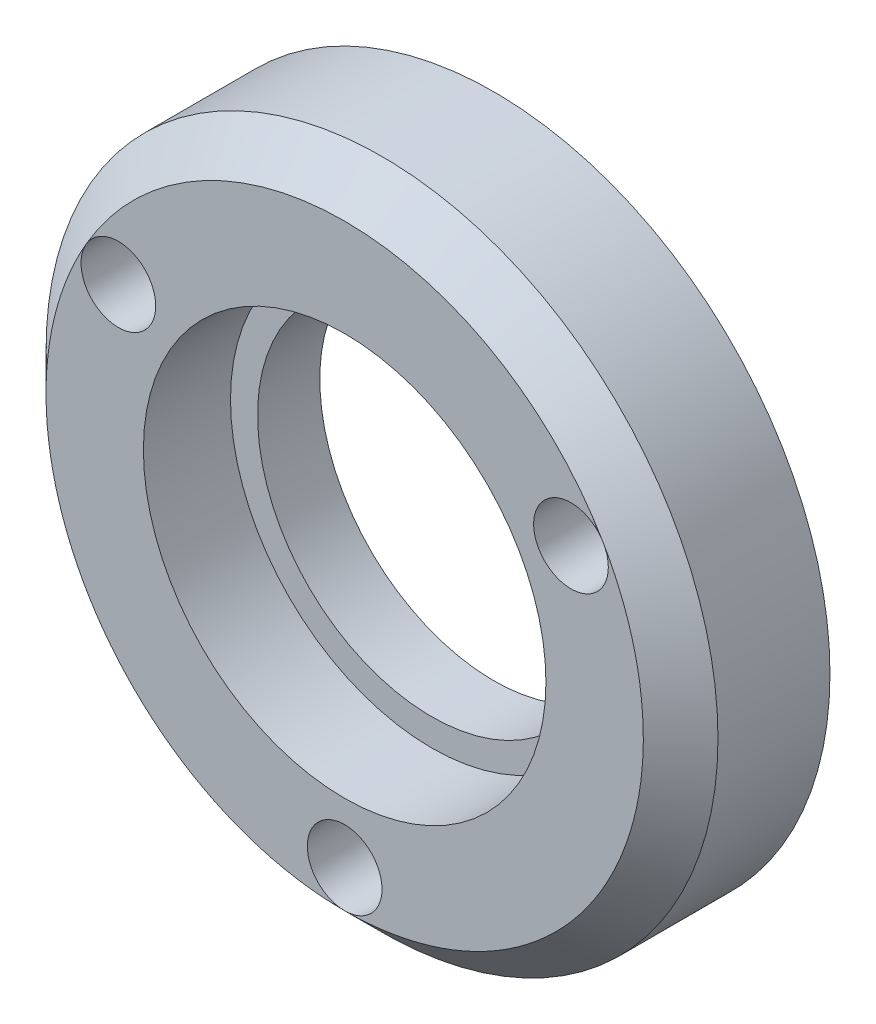
from build123d import *

# Parameters (mm, degrees)
SKETCH_1_R             = 27
EXTRUDE_420_DEPTH      = 12
SKETCH_2_R             = 16.175
CUT_EXTRUDE_563_DEPTH  = 7
SKETCH_3_R             = 14
CUT_EXTRUDE_654_DEPTH  = 39.820097888
SKETCH_5_R             = 1.65
CUT_EXTRUDE_1017_DEPTH = 41.024992192
SKETCH_6_R             = 3
CUT_EXTRUDE_1196_DEPTH = 5
CHAMFER_1_SIZE         = 1.5
CHAMFER_2_SIZE         = 3
SKETCH_8_R             = 3.65
CUT_EXTRUDE_1692_DEPTH = 3


# Some blends are built 0.0001 mm under size
with BuildPart() as part:
    # Эскиз1 → Extrude 420 (new body)
    with BuildSketch(Plane.XY):
        Circle(SKETCH_1_R)
    extrude(amount=EXTRUDE_420_DEPTH)

    # Эскиз2 → Cut-Extrude 563 (cut)
    with BuildSketch(Plane.XY.offset(12)):
        Circle(SKETCH_2_R)
    extrude(amount=-CUT_EXTRUDE_563_DEPTH, mode=Mode.SUBTRACT)

    # Эскиз3 → Cut-Extrude 654 (cut, through all)
    with BuildSketch(Plane.XY.offset(5)):
        Circle(SKETCH_3_R)
    extrude(amount=-CUT_EXTRUDE_654_DEPTH, mode=Mode.SUBTRACT)

    # Эскиз5 → Cut-Extrude 1017 (cut, through all)
    with BuildSketch(Plane.XY.offset(12)):
        with Locations((-18.186533479, 10.5)):
            Circle(SKETCH_5_R)
        with Locations((18.186533479, 10.5)):
            Circle(SKETCH_5_R)
        with Locations((0, -21)):
            Circle(SKETCH_5_R)
    extrude(amount=-CUT_EXTRUDE_1017_DEPTH, mode=Mode.SUBTRACT)

    # Эскиз6 → Cut-Extrude 1196 (cut)
    with BuildSketch(Plane.XY.offset(12)):
        with Locations((-18.186533479, 10.5)):
            Circle(SKETCH_6_R)
        with Locations((18.186533479, 10.5)):
            Circle(SKETCH_6_R)
        with Locations((0, -21)):
            Circle(SKETCH_6_R)
    extrude(amount=-CUT_EXTRUDE_1196_DEPTH, mode=Mode.SUBTRACT)

    # Фаска1
    # the kernel refuses this chamfer: 1.5 mm, written as the material it takes off along each edge
    with BuildSketch(Plane(origin=(0, -21, 7), x_dir=(1, 0, 0), z_dir=(0, -1, 0))) as chamfer_1_piece_1_section:
        Polygon((1.65, -CHAMFER_1_SIZE), (1.65 + CHAMFER_1_SIZE, 0), (1.65, 0), align=None)
    chamfer_1_piece_1 = revolve(axis=Axis((0, -21, 7), (0, 0, 1)), mode=Mode.PRIVATE)
    chamfer_1_piece_1 = chamfer_1_piece_1 & Plane(origin=(0, -21, 6.171694066), x_dir=(1, 0, 0), z_dir=(0, 0, 1)) * Cylinder(3, 13, mode=Mode.PRIVATE)
    add(chamfer_1_piece_1, mode=Mode.SUBTRACT)
    with BuildSketch(Plane(origin=(18.186533479, 10.5, 7), x_dir=(1, 0, 0), z_dir=(0, -1, 0))) as chamfer_1_piece_2_section:
        Polygon((1.65, -CHAMFER_1_SIZE), (1.65 + CHAMFER_1_SIZE, 0), (1.65, 0), align=None)
    chamfer_1_piece_2 = revolve(axis=Axis((18.186533479, 10.5, 7), (0, 0, 1)), mode=Mode.PRIVATE)
    chamfer_1_piece_2 = chamfer_1_piece_2 & Plane(origin=(18.186533479, 10.5, 6.171694066), x_dir=(1, 0, 0), z_dir=(0, 0, 1)) * Cylinder(3, 13, mode=Mode.PRIVATE)
    add(chamfer_1_piece_2, mode=Mode.SUBTRACT)
    with BuildSketch(Plane(origin=(-18.186533479, 10.5, 7), x_dir=(1, 0, 0), z_dir=(0, -1, 0))) as chamfer_1_piece_3_section:
        Polygon((1.65, -CHAMFER_1_SIZE), (1.65 + CHAMFER_1_SIZE, 0), (1.65, 0), align=None)
    chamfer_1_piece_3 = revolve(axis=Axis((-18.186533479, 10.5, 7), (0, 0, 1)), mode=Mode.PRIVATE)
    chamfer_1_piece_3 = chamfer_1_piece_3 & Plane(origin=(-18.186533479, 10.5, 6.171694066), x_dir=(1, 0, 0), z_dir=(0, 0, 1)) * Cylinder(3, 13, mode=Mode.PRIVATE)
    add(chamfer_1_piece_3, mode=Mode.SUBTRACT)

    # Фаска2
    chamfer_2_edges = [part.edges().sort_by_distance(p)[0] for p in [
        (-27, 0, 12),
    ]]
    chamfer(chamfer_2_edges, length=CHAMFER_2_SIZE - 0.0001)  # a hair under: the kernel refuses the full size

    # Эскиз8 → Cut-Extrude 1692 (cut)
    with BuildSketch(Plane(origin=(0, 0, 0), x_dir=(-1, 0, 0), z_dir=(0, 0, -1))):
        with Locations((0, 21)):
            Circle(SKETCH_8_R)
        with Locations((-18.186533479, -10.5)):
            Circle(SKETCH_8_R)
        with Locations((18.186533479, -10.5)):
            Circle(SKETCH_8_R)
    extrude(amount=-CUT_EXTRUDE_1692_DEPTH, mode=Mode.SUBTRACT)


solid = part.part
